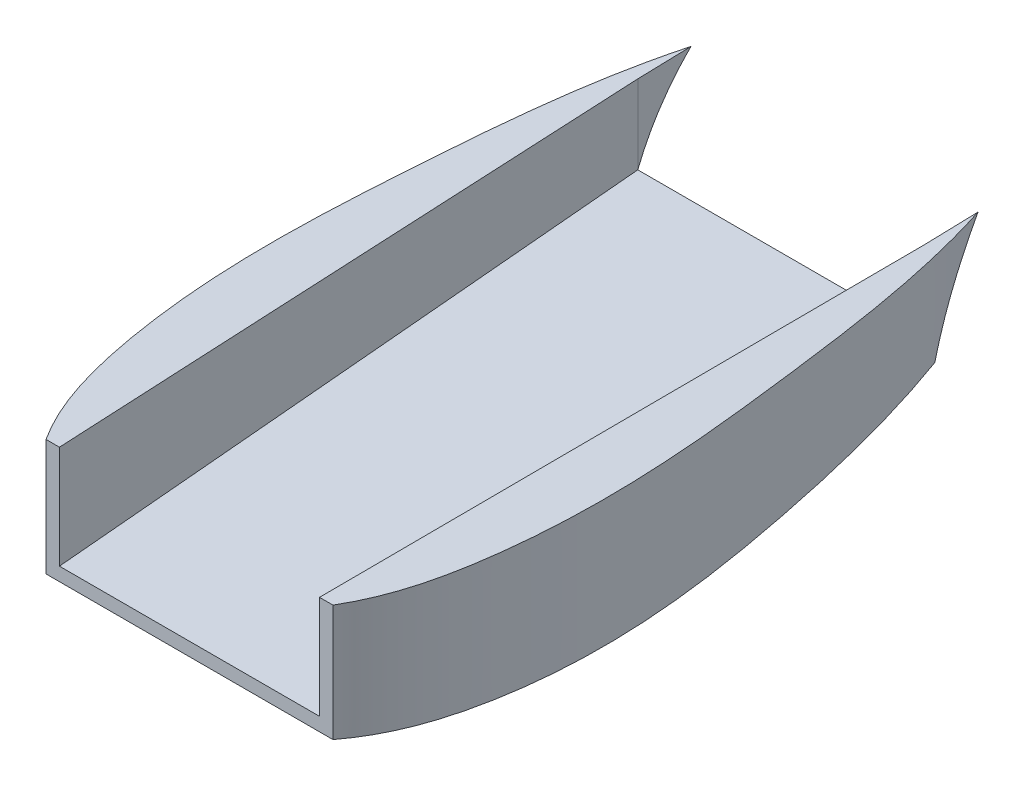
from build123d import *

# Parameters (mm, degrees)
BOSS_EXTRUDE2_DEPTH      = 45
BOSS_EXTRUDE2_DEPTH_BACK = 45
CUT_EXTRUDE3_START       = -27.249786541
CUT_EXTRUDE3_DEPTH       = 31.233789291


# Read off the part's stored shape, not the designer's step: Cut-Extrude3
with BuildPart() as part:
    # Sketch2 (on Right Plane) → Boss-Extrude2 (new, two sides: drawn at the far end of the back side and taken through both)
    with BuildSketch(Plane(origin=(0, 0, 0), x_dir=(0, 0, -1), z_dir=(1, 0, 0)).offset(-BOSS_EXTRUDE2_DEPTH_BACK)):
        with BuildLine():
            Line((0, 0), (143.987102048, 3.98400275))
            add(Edge.make_bspline(
                [(143.987102048, 3.98400275), (134.984630488, -4.921448011), (131.011727331, -16.925050269)],
                knots=[0, 0, 0, 1, 1, 1], degree=2))
            add(Edge.make_bspline(
                [(0, -26.002445347), (43.362857404, -29.056607153), (88.163793894, -26.676585526), (131.011727331, -16.925050269)],
                knots=[0, 0, 0, 0, 1, 1, 1, 1], degree=3))
            Line((0, -26.002445347), (0, 0))
        make_face()
    extrude(amount=BOSS_EXTRUDE2_DEPTH + BOSS_EXTRUDE2_DEPTH_BACK)

    # Cut-Extrude3 outline → Cut-Extrude3 (cut)
    with BuildSketch(Plane(origin=(0, 0, 0), x_dir=(1, 0, 0), z_dir=(0, 1, 0)).offset(CUT_EXTRUDE3_START)):
        with BuildLine():
            add(Edge.make_bspline(
                [(32.026201302, 0), (37.076161421, 7.923289645), (41.031245364, 22.834124934), (43.440169572, 45.655033799), (43.287987849, 67.756764471), (40.19763091, 101.225098423), (37.162532459, 127.048485942), (32.026201302, 143.987102048)],
                knots=[0, 0, 0, 0, 0.188938081, 0.312405275, 0.468938442, 0.640066909, 1, 1, 1, 1], degree=3))
            Line((32.026201302, 0), (45, 0))
            Line((45, 0), (45, 145))
            Line((45, 145), (-45, 145))
            Line((-45, 145), (-45, 0))
            Line((-45, 0), (-32.026201302, 0))
            add(Edge.make_bspline(
                [(-32.026201302, 0), (-37.076161421, 7.923289645), (-41.031245364, 22.834124934), (-43.440169572, 45.655033799), (-43.287987849, 67.756764471), (-40.19763091, 101.225098423), (-37.162532459, 127.048485942), (-32.026201302, 143.987102048)],
                knots=[0, 0, 0, 0, 0.188938081, 0.312405275, 0.468938442, 0.640066909, 1, 1, 1, 1], degree=3))
            Line((-32.026201302, 143.987102048), (-32.026201302, 132.09884068))
            Line((-32.026201302, 132.09884068), (32.026201302, 132.09884068))
            Line((32.026201302, 132.09884068), (32.026201302, 143.987102048))
        make_face()
    extrude(amount=CUT_EXTRUDE3_DEPTH, mode=Mode.SUBTRACT)

    # Sketch6 → Cut-Loft1 section 0
    with BuildSketch(Plane.XY):
        with BuildLine():
            Line((-29.026201302, 0), (-29.026201302, -23.002445347))
            Line((-29.026201302, -23.002445347), (29.026201302, -23.002445347))
            Line((29.026201302, -23.002445347), (29.026201302, 0))
            Line((29.026201302, 0), (-29.026201302, 0))
        make_face()
    # Sketch5 → Cut-Loft1 section 1
    with BuildSketch(Plane(origin=(0, 0, -132.09884068), x_dir=(-1, 0, 0), z_dir=(0, 0, -1))):
        with BuildLine():
            Line((-32.026201302, -13.933976996), (32.026201302, -13.933976996))
            Line((32.026201302, -13.933976996), (32.026201302, 3.655064496))
            Line((32.026201302, 3.655064496), (-32.026201302, 3.655064496))
            Line((-32.026201302, 3.655064496), (-32.026201302, -13.933976996))
        make_face()
    loft(mode=Mode.SUBTRACT)


solid = part.part
